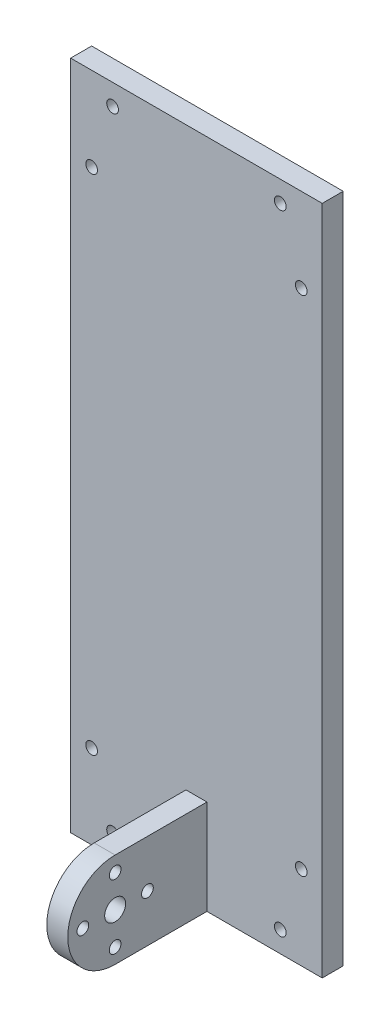
from build123d import *

# Parameters (mm, degrees)
SKETCH1_W           = 76.2
SKETCH1_H           = 203.2
BOSS_EXTRUDE1_DEPTH = 6.35
SKETCH2_W           = 6.35
SKETCH2_H           = 28.702
BOSS_EXTRUDE2_DEPTH = 44.45
SKETCH3_R           = 3.175
CUT_EXTRUDE1_DEPTH  = 6.35
SKETCH4_R           = 1.778
CUT_EXTRUDE2_DEPTH  = 6.35
CIRPATTERN1_COUNT   = 4
CUT_EXTRUDE3_DEPTH  = 6.35
SKETCH6_R           = 1.778
CUT_EXTRUDE4_DEPTH  = 6.35


with BuildPart() as part:
    # Sketch1 → Boss-Extrude1 (new body)
    with BuildSketch(Plane.XY):
        with Locations((38.1, 101.6)):
            Rectangle(SKETCH1_W, SKETCH1_H)
    extrude(amount=BOSS_EXTRUDE1_DEPTH)

    # Sketch2 → Boss-Extrude2 (add)
    with BuildSketch(Plane.XY.offset(6.35)):
        with Locations((38.1, 14.351)):
            Rectangle(SKETCH2_W, SKETCH2_H)
    extrude(amount=BOSS_EXTRUDE2_DEPTH)

    # Sketch3 → Cut-Extrude1 (cut)
    with BuildSketch(Plane(origin=(41.275, 0, 0), x_dir=(0, 0, -1), z_dir=(1, 0, 0))):
        with Locations((-34.154615714, 14.351)):
            Circle(SKETCH3_R)
    extrude(amount=-CUT_EXTRUDE1_DEPTH, mode=Mode.SUBTRACT)

    # Sketch4 → Cut-Extrude2 (cut)
    with BuildSketch(Plane(origin=(41.275, 0, 0), x_dir=(0, 0, -1), z_dir=(1, 0, 0))):
        with Locations((-43.933615714, 14.351)):
            Circle(SKETCH4_R)
    cut_extrude2 = extrude(amount=-CUT_EXTRUDE2_DEPTH, mode=Mode.SUBTRACT)

    # CirPattern1: Cut-Extrude2 ×4 about axis
    cirpattern1_axis = Axis((41.275, 14.351, 34.154615714), (1, 0, 0))
    for i in range(1, CIRPATTERN1_COUNT):
        add(cut_extrude2.rotate(cirpattern1_axis, i * 360 / CIRPATTERN1_COUNT), mode=Mode.SUBTRACT)

    # Sketch5 → Cut-Extrude3 (cut)
    with BuildSketch(Plane(origin=(41.275, 0, 0), x_dir=(0, 0, -1), z_dir=(1, 0, 0))):
        with BuildLine():
            ThreePointArc((-34.154615714, 0), (-48.505615714, 14.351), (-34.154615714, 28.702))
            Line((-34.154615714, 28.702), (-50.8, 28.702))
            Line((-50.8, 28.702), (-50.8, 0))
            Line((-50.8, 0), (-34.154615714, 0))
        make_face()
    extrude(amount=-CUT_EXTRUDE3_DEPTH, mode=Mode.SUBTRACT)

    # Sketch6 → Cut-Extrude4 (cut)
    with BuildSketch(Plane(origin=(0, 0, 0), x_dir=(-1, 0, 0), z_dir=(0, 0, -1))):
        with Locations((-63.5, 6.35)):
            Circle(SKETCH6_R)
        with Locations((-12.7, 6.35)):
            Circle(SKETCH6_R)
        with Locations((-6.35, 177.8)):
            Circle(SKETCH6_R)
        with Locations((-6.35, 25.4)):
            Circle(SKETCH6_R)
        with Locations((-69.85, 25.4)):
            Circle(SKETCH6_R)
        with Locations((-69.85, 177.8)):
            Circle(SKETCH6_R)
        with Locations((-63.5, 196.85)):
            Circle(SKETCH6_R)
        with Locations((-12.7, 196.85)):
            Circle(SKETCH6_R)
    extrude(amount=-CUT_EXTRUDE4_DEPTH, mode=Mode.SUBTRACT)


solid = part.part
